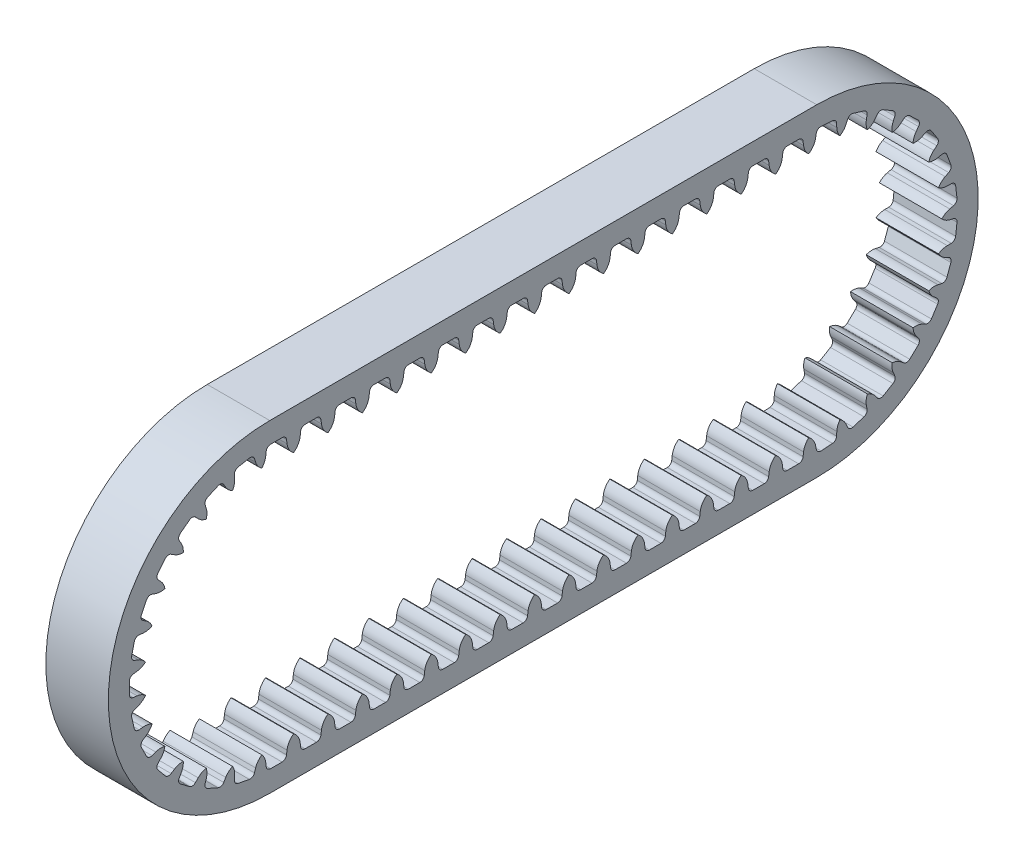
from build123d import *

# Parameters (mm, degrees)
SKETCH_2_W            = 6
SKETCH_2_H            = 3.8
CUT_EXTRUDE_1_DEPTH   = 70.800294398
PATTERN_START         = -3
PATTERN_CURVE_1_DEPTH = 6


# Read off the part's stored shape, not the designer's step: 曲线阵列1
with BuildPart() as part:
    # 扫描1: sweep along a path in 草图1
    with BuildLine(Plane(origin=(0, 0, 0), x_dir=(0, 0, -1), z_dir=(1, 0, 0))) as sweep_1_path:
        Line((0, 15.493), (52.5, 15.493))
        ThreePointArc((52.5, 15.493), (67.993, 0), (52.5, -15.493))
        Line((52.5, -15.493), (0, -15.493))
        ThreePointArc((0, -15.493), (-15.493, 0), (0, 15.493))
    # 草图2 → 扫描1 (sweep)
    with BuildSketch(Plane.XY):
        with Locations((0, 13.593)):
            Rectangle(SKETCH_2_W, SKETCH_2_H)
    sweep(path=sweep_1_path.line)

    # 草图3 → 切除-拉伸1 (cut, symmetric)
    with BuildSketch(Plane(origin=(0, 0, 0), x_dir=(0, 0, -1), z_dir=(1, 0, 0))):
        with BuildLine():
            Line((-13.482620058, 0.549918685), (-13.482620058, -0.549918685))
            ThreePointArc((-13.482620058, -0.549918685), (-13.375104421, -0.833701359), (-13.106539879, -0.975))
            Line((-13.106539879, -0.975), (-12.731034737, -1.021106234))
            ThreePointArc((-12.731034737, -1.021106234), (-11.796676034, -1.512696128), (-11.422620058, -2.5))
            Line((-11.422620058, -2.5), (-9.002225663, -2.5))
            Line((-9.002225663, -2.5), (-9.002225663, 2.5))
            Line((-9.002225663, 2.5), (-11.422620058, 2.5))
            ThreePointArc((-11.422620058, 2.5), (-11.796676034, 1.512696128), (-12.731034737, 1.021106234))
            Line((-12.731034737, 1.021106234), (-13.106539879, 0.975))
            ThreePointArc((-13.106539879, 0.975), (-13.375104421, 0.833701359), (-13.482620058, 0.549918685))
        make_face()
    extrude(amount=CUT_EXTRUDE_1_DEPTH, both=True, mode=Mode.SUBTRACT)

    # 曲线阵列1 outline → 曲线阵列1 (cut)
    with BuildSketch(Plane.YZ.offset(PATTERN_START)):
        with BuildLine():
            Line((11.693, 0), (11.693, -2.278786114))
            ThreePointArc((11.693, -2.278786114), (12.145897725, -1.857132137), (12.731034737, -1.655828627))
            Line((12.731034737, -1.655828627), (13.106539879, -1.609722393))
            ThreePointArc((13.106539879, -1.609722393), (13.37510442, -1.468423753), (13.482620058, -1.184641078))
            Line((13.482620058, -1.184641078), (13.482620058, -0.084803708))
            ThreePointArc((13.482620058, -0.084803708), (13.375104421, 0.198978967), (13.106539879, 0.340277607))
            Line((13.106539879, 0.340277607), (12.731034737, 0.386383841))
            ThreePointArc((12.731034737, 0.386383841), (12.292237647, 0.510572597), (11.911554283, 0.761662043))
            ThreePointArc((11.911554283, 0.761662043), (12.254961467, 1.126099695), (12.699710751, 1.356189612))
            Line((12.699710751, 1.356189612), (13.060164419, 1.471094137))
            ThreePointArc((13.060164419, 1.471094137), (13.297887129, 1.659721102), (13.350942903, 1.95851418))
            Line((13.350942903, 1.95851418), (13.147096097, 3.039295712))
            ThreePointArc((13.147096097, 3.039295712), (12.988846239, 3.298234317), (12.698746191, 3.387308338))
            Line((12.698746191, 3.387308338), (12.321201617, 3.363018603))
            ThreePointArc((12.321201617, 3.363018603), (11.877365704, 3.401194823), (11.464651873, 3.568870209))
            ThreePointArc((11.464651873, 3.568870209), (11.709274939, 3.941170218), (12.053023134, 4.224516155))
            Line((12.053023134, 4.224516155), (12.3776475, 4.418806962))
            ThreePointArc((12.3776475, 4.418806962), (12.56593389, 4.656799513), (12.549253423, 4.959807732))
            Line((12.549253423, 4.959807732), (12.103647301, 5.96533119))
            ThreePointArc((12.103647301, 5.96533119), (11.890375049, 6.181218117), (11.58759257, 6.201589396))
            Line((11.58759257, 6.201589396), (11.225607734, 6.091603599))
            ThreePointArc((11.225607734, 6.091603599), (10.784803103, 6.027268396), (10.344680967, 6.096117848))
            ThreePointArc((10.344680967, 6.096117848), (10.497681114, 6.51449411), (10.76752225, 6.868942276))
            Line((10.76752225, 6.868942276), (11.039112142, 7.132321903))
            ThreePointArc((11.039112142, 7.132321903), (11.167982984, 7.407066375), (11.082450345, 7.698230223))
            Line((11.082450345, 7.698230223), (10.418702146, 8.57520261))
            ThreePointArc((10.418702146, 8.57520261), (10.161710983, 8.736595797), (9.862293619, 8.687184652))
            Line((9.862293619, 8.687184652), (9.53505381, 8.497332067))
            ThreePointArc((9.53505381, 8.497332067), (9.120643217, 8.333895223), (8.676439361, 8.300269704))
            ThreePointArc((8.676439361, 8.300269704), (8.729707542, 8.742548171), (8.911339971, 9.149312724))
            Line((8.911339971, 9.149312724), (9.115501055, 9.467821985))
            ThreePointArc((9.115501055, 9.467821985), (9.178126164, 9.764756851), (9.028274602, 10.02864457))
            Line((9.028274602, 10.02864457), (8.181563148, 10.730586128))
            ThreePointArc((8.181563148, 10.730586128), (7.894473671, 10.828931697), (7.614290619, 10.712356929))
            Line((7.614290619, 10.712356929), (7.339139628, 10.452699791))
            ThreePointArc((7.339139628, 10.452699791), (6.973086939, 10.198823502), (6.548344279, 10.064505171))
            ThreePointArc((6.548344279, 10.064505171), (6.499057268, 10.507244972), (6.582854426, 10.944767289))
            Line((6.582854426, 10.944767289), (6.708766112, 11.301525112))
            ThreePointArc((6.708766112, 11.301525112), (6.701826341, 11.604912749), (6.495598029, 11.827538224))
            Line((6.495598029, 11.827538224), (5.510799239, 12.317245875))
            ThreePointArc((5.510799239, 12.317245875), (5.208827262, 12.347331484), (4.962728295, 12.169771587))
            Line((4.962728295, 12.169771587), (4.754249195, 11.85407179))
            ThreePointArc((4.754249195, 11.85407179), (4.455955295, 11.523211562), (4.073185299, 11.295319325))
            ThreePointArc((4.073185299, 11.295319325), (3.923955319, 11.71505514), (3.905475935, 12.160146427))
            Line((3.905475935, 12.160146427), (3.946464873, 12.536244558))
            ThreePointArc((3.946464873, 12.536244558), (3.870328031, 12.830005345), (3.618653121, 12.999569369))
            Line((3.618653121, 12.999569369), (2.54796158, 13.251088483))
            ThreePointArc((2.54796158, 13.251088483), (2.247111695, 13.211319588), (2.048140119, 12.982185281))
            Line((2.048140119, 12.982185281), (1.917382355, 12.627174994))
            ThreePointArc((1.917382355, 12.627174994), (1.702656896, 12.236866502), (1.38214647, 11.927478705))
            ThreePointArc((1.38214647, 11.927478705), (1.639780157, 11.696017485), (1.943890519, 11.530287882))
            ThreePointArc((1.943890519, 11.530287882), (8.929058204, 7.549713145), (11.693, 0))
        make_face()
        with BuildLine():
            Line((11.693, -2.295855782), (11.693, -5.583983225))
            ThreePointArc((11.693, -5.583983225), (12.145897725, -5.162329247), (12.731034737, -4.961025738))
            Line((12.731034737, -4.961025738), (13.106539879, -4.914919503))
            ThreePointArc((13.106539879, -4.914919503), (13.375104421, -4.773620863), (13.482620058, -4.489838188))
            Line((13.482620058, -4.489838188), (13.482620058, -3.390000819))
            ThreePointArc((13.482620058, -3.390000819), (13.375104421, -3.106218144), (13.106539879, -2.964919503))
            Line((13.106539879, -2.964919503), (12.731034737, -2.918813269))
            ThreePointArc((12.731034737, -2.918813269), (12.145897725, -2.71750976), (11.693, -2.295855782))
        make_face()
        with BuildLine():
            Line((11.693, -5.601052893), (11.693, -8.889180335))
            ThreePointArc((11.693, -8.889180335), (12.145897725, -8.467526358), (12.731034737, -8.266222848))
            Line((12.731034737, -8.266222848), (13.106539879, -8.220116614))
            ThreePointArc((13.106539879, -8.220116614), (13.37510442, -8.078817974), (13.482620058, -7.795035299))
            Line((13.482620058, -7.795035299), (13.482620058, -6.695197929))
            ThreePointArc((13.482620058, -6.695197929), (13.37510442, -6.411415254), (13.106539879, -6.270116614))
            Line((13.106539879, -6.270116614), (12.731034737, -6.22401038))
            ThreePointArc((12.731034737, -6.22401038), (12.145897725, -6.02270687), (11.693, -5.601052893))
        make_face()
        with BuildLine():
            Line((11.693, -8.906250003), (11.693, -12.194377446))
            ThreePointArc((11.693, -12.194377446), (12.145897725, -11.772723468), (12.731034737, -11.571419959))
            Line((12.731034737, -11.571419959), (13.106539879, -11.525313725))
            ThreePointArc((13.106539879, -11.525313725), (13.375104421, -11.384015084), (13.482620058, -11.100232409))
            Line((13.482620058, -11.100232409), (13.482620058, -10.00039504))
            ThreePointArc((13.482620058, -10.00039504), (13.375104421, -9.716612365), (13.106539879, -9.575313725))
            Line((13.106539879, -9.575313725), (12.731034737, -9.529207491))
            ThreePointArc((12.731034737, -9.529207491), (12.145897725, -9.327903981), (11.693, -8.906250003))
        make_face()
        with BuildLine():
            Line((11.693, -12.211447114), (11.693, -15.499574557))
            ThreePointArc((11.693, -15.499574557), (12.145897725, -15.077920579), (12.731034737, -14.876617069))
            Line((12.731034737, -14.876617069), (13.106539879, -14.830510835))
            ThreePointArc((13.106539879, -14.830510835), (13.375104421, -14.689212195), (13.482620058, -14.40542952))
            Line((13.482620058, -14.40542952), (13.482620058, -13.30559215))
            ThreePointArc((13.482620058, -13.30559215), (13.37510442, -13.021809475), (13.106539879, -12.880510835))
            Line((13.106539879, -12.880510835), (12.731034737, -12.834404601))
            ThreePointArc((12.731034737, -12.834404601), (12.145897725, -12.633101092), (11.693, -12.211447114))
        make_face()
        with BuildLine():
            Line((11.693, -15.516644224), (11.693, -18.804771667))
            ThreePointArc((11.693, -18.804771667), (12.145897725, -18.38311769), (12.731034737, -18.18181418))
            Line((12.731034737, -18.18181418), (13.106539879, -18.135707946))
            ThreePointArc((13.106539879, -18.135707946), (13.37510442, -17.994409306), (13.482620058, -17.710626631))
            Line((13.482620058, -17.710626631), (13.482620058, -16.610789261))
            ThreePointArc((13.482620058, -16.610789261), (13.375104421, -16.327006586), (13.106539879, -16.185707946))
            Line((13.106539879, -16.185707946), (12.731034737, -16.139601712))
            ThreePointArc((12.731034737, -16.139601712), (12.145897725, -15.938298202), (11.693, -15.516644224))
        make_face()
        with BuildLine():
            Line((11.693, -18.821841335), (11.693, -22.109968778))
            ThreePointArc((11.693, -22.109968778), (12.145897725, -21.6883148), (12.731034737, -21.487011291))
            Line((12.731034737, -21.487011291), (13.106539879, -21.440905056))
            ThreePointArc((13.106539879, -21.440905056), (13.375104421, -21.299606416), (13.482620058, -21.015823741))
            Line((13.482620058, -21.015823741), (13.482620058, -19.915986372))
            ThreePointArc((13.482620058, -19.915986372), (13.375104421, -19.632203697), (13.106539879, -19.490905056))
            Line((13.106539879, -19.490905056), (12.731034737, -19.444798822))
            ThreePointArc((12.731034737, -19.444798822), (12.145897725, -19.243495313), (11.693, -18.821841335))
        make_face()
        with BuildLine():
            Line((11.693, -22.127038446), (11.693, -25.415165888))
            ThreePointArc((11.693, -25.415165888), (12.145897725, -24.993511911), (12.731034737, -24.792208401))
            Line((12.731034737, -24.792208401), (13.106539879, -24.746102167))
            ThreePointArc((13.106539879, -24.746102167), (13.37510442, -24.604803527), (13.482620058, -24.321020852))
            Line((13.482620058, -24.321020852), (13.482620058, -23.221183482))
            ThreePointArc((13.482620058, -23.221183482), (13.37510442, -22.937400807), (13.106539879, -22.796102167))
            Line((13.106539879, -22.796102167), (12.731034737, -22.749995933))
            ThreePointArc((12.731034737, -22.749995933), (12.145897725, -22.548692423), (11.693, -22.127038446))
        make_face()
        with BuildLine():
            Line((11.693, -25.432235556), (11.693, -28.720362999))
            ThreePointArc((11.693, -28.720362999), (12.145897725, -28.298709021), (12.731034737, -28.097405512))
            Line((12.731034737, -28.097405512), (13.106539879, -28.051299278))
            ThreePointArc((13.106539879, -28.051299278), (13.375104421, -27.910000637), (13.482620058, -27.626217962))
            Line((13.482620058, -27.626217962), (13.482620058, -26.526380593))
            ThreePointArc((13.482620058, -26.526380593), (13.375104421, -26.242597918), (13.106539879, -26.101299278))
            Line((13.106539879, -26.101299278), (12.731034737, -26.055193044))
            ThreePointArc((12.731034737, -26.055193044), (12.145897725, -25.853889534), (11.693, -25.432235556))
        make_face()
        with BuildLine():
            Line((11.693, -28.737432667), (11.693, -32.02556011))
            ThreePointArc((11.693, -32.02556011), (12.145897725, -31.603906132), (12.731034737, -31.402602622))
            Line((12.731034737, -31.402602622), (13.106539879, -31.356496388))
            ThreePointArc((13.106539879, -31.356496388), (13.375104421, -31.215197748), (13.482620058, -30.931415073))
            Line((13.482620058, -30.931415073), (13.482620058, -29.831577703))
            ThreePointArc((13.482620058, -29.831577703), (13.37510442, -29.547795028), (13.106539879, -29.406496388))
            Line((13.106539879, -29.406496388), (12.731034737, -29.360390154))
            ThreePointArc((12.731034737, -29.360390154), (12.145897725, -29.159086645), (11.693, -28.737432667))
        make_face()
        with BuildLine():
            Line((11.693, -32.042629777), (11.693, -35.33075722))
            ThreePointArc((11.693, -35.33075722), (12.145897725, -34.909103243), (12.731034737, -34.707799733))
            Line((12.731034737, -34.707799733), (13.106539879, -34.661693499))
            ThreePointArc((13.106539879, -34.661693499), (13.37510442, -34.520394859), (13.482620058, -34.236612184))
            Line((13.482620058, -34.236612184), (13.482620058, -33.136774814))
            ThreePointArc((13.482620058, -33.136774814), (13.375104421, -32.852992139), (13.106539879, -32.711693499))
            Line((13.106539879, -32.711693499), (12.731034737, -32.665587265))
            ThreePointArc((12.731034737, -32.665587265), (12.145897725, -32.464283755), (11.693, -32.042629777))
        make_face()
        with BuildLine():
            Line((11.693, -35.347826888), (11.693, -38.635954331))
            ThreePointArc((11.693, -38.635954331), (12.145897725, -38.214300353), (12.731034737, -38.012996844))
            Line((12.731034737, -38.012996844), (13.106539879, -37.966890609))
            ThreePointArc((13.106539879, -37.966890609), (13.375104421, -37.825591969), (13.482620058, -37.541809294))
            Line((13.482620058, -37.541809294), (13.482620058, -36.441971925))
            ThreePointArc((13.482620058, -36.441971925), (13.375104421, -36.15818925), (13.106539879, -36.016890609))
            Line((13.106539879, -36.016890609), (12.731034737, -35.970784375))
            ThreePointArc((12.731034737, -35.970784375), (12.145897725, -35.769480866), (11.693, -35.347826888))
        make_face()
        with BuildLine():
            Line((11.693, -38.653023999), (11.693, -41.941151441))
            ThreePointArc((11.693, -41.941151441), (12.145897725, -41.519497464), (12.731034737, -41.318193954))
            Line((12.731034737, -41.318193954), (13.106539879, -41.27208772))
            ThreePointArc((13.106539879, -41.27208772), (13.37510442, -41.13078908), (13.482620058, -40.847006405))
            Line((13.482620058, -40.847006405), (13.482620058, -39.747169035))
            ThreePointArc((13.482620058, -39.747169035), (13.37510442, -39.46338636), (13.106539879, -39.32208772))
            Line((13.106539879, -39.32208772), (12.731034737, -39.275981486))
            ThreePointArc((12.731034737, -39.275981486), (12.145897725, -39.074677976), (11.693, -38.653023999))
        make_face()
        with BuildLine():
            Line((11.693, -41.958221109), (11.693, -45.246348552))
            ThreePointArc((11.693, -45.246348552), (12.145897725, -44.824694574), (12.731034737, -44.623391065))
            Line((12.731034737, -44.623391065), (13.106539879, -44.577284831))
            ThreePointArc((13.106539879, -44.577284831), (13.375104421, -44.43598619), (13.482620058, -44.152203515))
            Line((13.482620058, -44.152203515), (13.482620058, -43.052366146))
            ThreePointArc((13.482620058, -43.052366146), (13.375104421, -42.768583471), (13.106539879, -42.627284831))
            Line((13.106539879, -42.627284831), (12.731034737, -42.581178597))
            ThreePointArc((12.731034737, -42.581178597), (12.145897725, -42.379875087), (11.693, -41.958221109))
        make_face()
        with BuildLine():
            Line((11.693, -45.26341822), (11.693, -48.551545663))
            ThreePointArc((11.693, -48.551545663), (12.145897725, -48.129891685), (12.731034737, -47.928588175))
            Line((12.731034737, -47.928588175), (13.106539879, -47.882481941))
            ThreePointArc((13.106539879, -47.882481941), (13.375104421, -47.741183301), (13.482620058, -47.457400626))
            Line((13.482620058, -47.457400626), (13.482620058, -46.357563256))
            ThreePointArc((13.482620058, -46.357563256), (13.37510442, -46.073780581), (13.106539879, -45.932481941))
            Line((13.106539879, -45.932481941), (12.731034737, -45.886375707))
            ThreePointArc((12.731034737, -45.886375707), (12.145897725, -45.685072198), (11.693, -45.26341822))
        make_face()
        with BuildLine():
            Line((-11.693, -52.5), (-11.693, -48.56861533))
            ThreePointArc((-11.693, -48.56861533), (-12.145897725, -48.990269308), (-12.731034737, -49.191572818))
            Line((-12.731034737, -49.191572818), (-13.106539879, -49.237679052))
            ThreePointArc((-13.106539879, -49.237679052), (-13.375104421, -49.378977692), (-13.482620058, -49.662760367))
            Line((-13.482620058, -49.662760367), (-13.482620058, -50.762597737))
            ThreePointArc((-13.482620058, -50.762597737), (-13.37510442, -51.046380412), (-13.106539879, -51.187679052))
            Line((-13.106539879, -51.187679052), (-12.731034737, -51.233785286))
            ThreePointArc((-12.731034737, -51.233785286), (-12.220915878, -51.392964944), (-11.799767173, -51.721892266))
            ThreePointArc((-11.799767173, -51.721892266), (-12.217330876, -52.153571456), (-12.771403722, -52.385324885))
            Line((-12.771403722, -52.385324885), (-13.142687946, -52.457974193))
            ThreePointArc((-13.142687946, -52.457974193), (-13.400543129, -52.617983328), (-13.487639984, -52.908683098))
            Line((-13.487639984, -52.908683098), (-13.409555765, -54.005745127))
            ThreePointArc((-13.409555765, -54.005745127), (-13.282163956, -54.281178505), (-13.004245454, -54.403053543))
            Line((-13.004245454, -54.403053543), (-12.6264145, -54.422384013))
            ThreePointArc((-12.6264145, -54.422384013), (-12.189923242, -54.511395942), (-11.799253703, -54.725463812))
            ThreePointArc((-11.799253703, -54.725463812), (-12.085105781, -55.0671308), (-12.459184684, -55.309024819))
            Line((-12.459184684, -55.309024819), (-12.804015836, -55.464656991))
            ThreePointArc((-12.804015836, -55.464656991), (-13.018445728, -55.679394133), (-13.036755086, -55.98230829))
            Line((-13.036755086, -55.98230829), (-12.709855682, -57.032441148))
            ThreePointArc((-12.709855682, -57.032441148), (-12.522851587, -57.271442586), (-12.224426656, -57.326531418))
            Line((-12.224426656, -57.326531418), (-11.852187633, -57.258944393))
            ThreePointArc((-11.852187633, -57.258944393), (-11.406907529, -57.245777378), (-10.977636125, -57.364831163))
            ThreePointArc((-10.977636125, -57.364831163), (-11.1777781, -57.762814745), (-11.486625714, -58.083845729))
            Line((-11.486625714, -58.083845729), (-11.786727657, -58.31421222))
            ThreePointArc((-11.786727657, -58.31421222), (-11.946367419, -58.572296248), (-11.89491888, -58.871370263))
            Line((-11.89491888, -58.871370263), (-11.336530041, -59.818916644))
            ThreePointArc((-11.336530041, -59.818916644), (-11.099824925, -60.008819006), (-10.796710162, -59.994201911))
            Line((-10.796710162, -59.994201911), (-10.449791831, -59.84327952))
            ThreePointArc((-10.449791831, -59.84327952), (-10.019322838, -59.728631417), (-9.574201062, -59.746361235))
            ThreePointArc((-9.574201062, -59.746361235), (-9.67802536, -60.17956818), (-9.905272683, -60.562721407))
            Line((-9.905272683, -60.562721407), (-10.144739939, -60.855612735))
            ThreePointArc((-10.144739939, -60.855612735), (-10.241128622, -61.14336513), (-10.122648973, -61.422748006))
            Line((-10.122648973, -61.422748006), (-9.362365448, -62.217487712))
            ThreePointArc((-9.362365448, -62.217487712), (-9.088504742, -62.348226124), (-8.796765306, -62.264677811))
            Line((-8.796765306, -62.264677811), (-8.493554426, -62.038418979))
            ThreePointArc((-8.493554426, -62.038418979), (-8.100711509, -61.828366166), (-7.663330928, -61.743832334))
            ThreePointArc((-7.663330928, -61.743832334), (-7.665334834, -62.189302564), (-7.798937702, -62.614270816))
            Line((-7.798937702, -62.614270816), (-7.965078445, -62.954163667))
            ThreePointArc((-7.965078445, -62.954163667), (-7.993107426, -63.256333479), (-7.813876116, -63.501217852))
            Line((-7.813876116, -63.501217852), (-6.891993124, -64.101029479))
            ThreePointArc((-6.891993124, -64.101029479), (-6.595491514, -64.165674773), (-6.330589669, -64.017623325))
            Line((-6.330589669, -64.017623325), (-6.087156494, -63.728019827))
            ThreePointArc((-6.087156494, -63.728019827), (-5.752760428, -63.433695155), (-5.346302322, -63.251377987))
            ThreePointArc((-5.346302322, -63.251377987), (-5.246379628, -63.685501468), (-5.279257055, -64.12976132))
            Line((-5.279257055, -64.12976132), (-5.363265783, -64.498641288))
            ThreePointArc((-5.363265783, -64.498641288), (-5.321449519, -64.79921344), (-5.090965854, -64.996620378))
            Line((-5.090965854, -64.996620378), (-4.056343426, -65.369713758))
            ThreePointArc((-4.056343426, -65.369713758), (-3.752915572, -65.364839717), (-3.528891183, -65.160131896))
            Line((-3.528891183, -65.160131896), (-3.358137732, -64.822532791))
            ThreePointArc((-3.358137732, -64.822532791), (-3.099911591, -64.459535543), (-2.745918343, -64.189097894))
            ThreePointArc((-2.745918343, -64.189097894), (-2.549364978, -64.588865972), (-2.479774452, -65.028871541))
            Line((-2.479774452, -65.028871541), (-2.477198682, -65.407187893))
            ThreePointArc((-2.477198682, -65.407187893), (-2.367753445, -65.690231986), (-2.098233118, -65.829698871))
            Line((-2.098233118, -65.829698871), (-1.005706503, -65.956299961))
            ThreePointArc((-1.005706503, -65.956299961), (-0.711434158, -65.882164909), (-0.540160574, -65.631650283))
            Line((-0.540160574, -65.631650283), (-0.451136823, -65.263948409))
            ThreePointArc((-0.451136823, -65.263948409), (-0.282766659, -64.85151753), (0, -64.507292664))
            ThreePointArc((0, -64.507292664), (0.282766659, -64.85151753), (0.451136823, -65.263948409))
            Line((0.451136823, -65.263948409), (0.540160574, -65.631650283))
            ThreePointArc((0.540160574, -65.631650283), (0.711434158, -65.882164909), (1.005706503, -65.956299961))
            Line((1.005706503, -65.956299961), (2.098233118, -65.829698871))
            ThreePointArc((2.098233118, -65.829698871), (2.367753445, -65.690231986), (2.477198682, -65.407187893))
            Line((2.477198682, -65.407187893), (2.479774452, -65.028871541))
            ThreePointArc((2.479774452, -65.028871541), (2.549364978, -64.588865972), (2.745918343, -64.189097894))
            ThreePointArc((2.745918343, -64.189097894), (3.099911591, -64.459535543), (3.358137732, -64.822532791))
            Line((3.358137732, -64.822532791), (3.528891183, -65.160131896))
            ThreePointArc((3.528891183, -65.160131896), (3.752915572, -65.364839717), (4.056343426, -65.369713758))
            Line((4.056343426, -65.369713758), (5.090965854, -64.996620378))
            ThreePointArc((5.090965854, -64.996620378), (5.321449519, -64.79921344), (5.363265783, -64.498641288))
            Line((5.363265783, -64.498641288), (5.279257055, -64.12976132))
            ThreePointArc((5.279257055, -64.12976132), (5.246379628, -63.685501468), (5.346302322, -63.251377987))
            ThreePointArc((5.346302322, -63.251377987), (5.752760428, -63.433695155), (6.087156494, -63.728019827))
            Line((6.087156494, -63.728019827), (6.330589669, -64.017623325))
            ThreePointArc((6.330589669, -64.017623325), (6.595491514, -64.165674773), (6.891993124, -64.101029479))
            Line((6.891993124, -64.101029479), (7.813876116, -63.501217852))
            ThreePointArc((7.813876116, -63.501217852), (7.993107426, -63.256333479), (7.965078445, -62.954163667))
            Line((7.965078445, -62.954163667), (7.798937702, -62.614270816))
            ThreePointArc((7.798937702, -62.614270816), (7.665334834, -62.189302564), (7.663330928, -61.743832334))
            ThreePointArc((7.663330928, -61.743832334), (8.100711509, -61.828366166), (8.493554426, -62.038418979))
            Line((8.493554426, -62.038418979), (8.796765306, -62.264677811))
            ThreePointArc((8.796765306, -62.264677811), (9.088504742, -62.348226124), (9.362365448, -62.217487712))
            Line((9.362365448, -62.217487712), (10.122648973, -61.422748006))
            ThreePointArc((10.122648973, -61.422748006), (10.241128622, -61.14336513), (10.144739939, -60.855612735))
            Line((10.144739939, -60.855612735), (9.905272683, -60.562721407))
            ThreePointArc((9.905272683, -60.562721407), (9.67802536, -60.17956818), (9.574201062, -59.746361235))
            ThreePointArc((9.574201062, -59.746361235), (10.019322838, -59.728631417), (10.449791831, -59.84327952))
            Line((10.449791831, -59.84327952), (10.796710162, -59.994201911))
            ThreePointArc((10.796710162, -59.994201911), (11.099824925, -60.008819006), (11.336530041, -59.818916644))
            Line((11.336530041, -59.818916644), (11.89491888, -58.871370263))
            ThreePointArc((11.89491888, -58.871370263), (11.946367419, -58.572296248), (11.786727657, -58.31421222))
            Line((11.786727657, -58.31421222), (11.486625714, -58.083845729))
            ThreePointArc((11.486625714, -58.083845729), (11.1777781, -57.762814745), (10.977636125, -57.364831163))
            ThreePointArc((10.977636125, -57.364831163), (11.406907529, -57.245777378), (11.852187633, -57.258944393))
            Line((11.852187633, -57.258944393), (12.224426656, -57.326531418))
            ThreePointArc((12.224426656, -57.326531418), (12.522851587, -57.271442586), (12.709855682, -57.032441148))
            Line((12.709855682, -57.032441148), (13.036755086, -55.98230829))
            ThreePointArc((13.036755086, -55.98230829), (13.018445728, -55.679394133), (12.804015836, -55.464656991))
            Line((12.804015836, -55.464656991), (12.459184684, -55.309024819))
            ThreePointArc((12.459184684, -55.309024819), (12.085105781, -55.0671308), (11.799253703, -54.725463812))
            ThreePointArc((11.799253703, -54.725463812), (12.189923242, -54.511395942), (12.6264145, -54.422384013))
            Line((12.6264145, -54.422384013), (13.004245454, -54.403053543))
            ThreePointArc((13.004245454, -54.403053543), (13.282163956, -54.281178505), (13.409555765, -54.005745127))
            Line((13.409555765, -54.005745127), (13.487639984, -52.908683098))
            ThreePointArc((13.487639984, -52.908683098), (13.400543129, -52.617983328), (13.142687946, -52.457974193))
            Line((13.142687946, -52.457974193), (12.771403722, -52.385324885))
            ThreePointArc((12.771403722, -52.385324885), (12.217330876, -52.153571456), (11.799767173, -51.721892266))
            ThreePointArc((11.799767173, -51.721892266), (12.220915878, -51.392964944), (12.731034737, -51.233785286))
            Line((12.731034737, -51.233785286), (13.106539879, -51.187679052))
            ThreePointArc((13.106539879, -51.187679052), (13.37510442, -51.046380412), (13.482620058, -50.762597737))
            Line((13.482620058, -50.762597737), (13.482620058, -49.662760367))
            ThreePointArc((13.482620058, -49.662760367), (13.375104421, -49.378977692), (13.106539879, -49.237679052))
            Line((13.106539879, -49.237679052), (12.731034737, -49.191572818))
            ThreePointArc((12.731034737, -49.191572818), (12.145897725, -48.990269308), (11.693, -48.56861533))
            Line((11.693, -48.56861533), (11.693, -52.5))
            ThreePointArc((11.693, -52.5), (0, -64.193), (-11.693, -52.5))
        make_face()
        with BuildLine():
            Line((-11.693, -48.551545663), (-11.693, -45.26341822))
            ThreePointArc((-11.693, -45.26341822), (-12.145897725, -45.685072198), (-12.731034737, -45.886375707))
            Line((-12.731034737, -45.886375707), (-13.106539879, -45.932481941))
            ThreePointArc((-13.106539879, -45.932481941), (-13.37510442, -46.073780581), (-13.482620058, -46.357563256))
            Line((-13.482620058, -46.357563256), (-13.482620058, -47.457400626))
            ThreePointArc((-13.482620058, -47.457400626), (-13.375104421, -47.741183301), (-13.106539879, -47.882481941))
            Line((-13.106539879, -47.882481941), (-12.731034737, -47.928588175))
            ThreePointArc((-12.731034737, -47.928588175), (-12.145897725, -48.129891685), (-11.693, -48.551545663))
        make_face()
        with BuildLine():
            Line((-11.693, -45.246348552), (-11.693, -41.958221109))
            ThreePointArc((-11.693, -41.958221109), (-12.145897725, -42.379875087), (-12.731034737, -42.581178597))
            Line((-12.731034737, -42.581178597), (-13.106539879, -42.627284831))
            ThreePointArc((-13.106539879, -42.627284831), (-13.375104421, -42.768583471), (-13.482620058, -43.052366146))
            Line((-13.482620058, -43.052366146), (-13.482620058, -44.152203515))
            ThreePointArc((-13.482620058, -44.152203515), (-13.375104421, -44.43598619), (-13.106539879, -44.577284831))
            Line((-13.106539879, -44.577284831), (-12.731034737, -44.623391065))
            ThreePointArc((-12.731034737, -44.623391065), (-12.145897725, -44.824694574), (-11.693, -45.246348552))
        make_face()
        with BuildLine():
            Line((-11.693, -41.941151441), (-11.693, -38.653023999))
            ThreePointArc((-11.693, -38.653023999), (-12.145897725, -39.074677976), (-12.731034737, -39.275981486))
            Line((-12.731034737, -39.275981486), (-13.106539879, -39.32208772))
            ThreePointArc((-13.106539879, -39.32208772), (-13.37510442, -39.46338636), (-13.482620058, -39.747169035))
            Line((-13.482620058, -39.747169035), (-13.482620058, -40.847006405))
            ThreePointArc((-13.482620058, -40.847006405), (-13.37510442, -41.13078908), (-13.106539879, -41.27208772))
            Line((-13.106539879, -41.27208772), (-12.731034737, -41.318193954))
            ThreePointArc((-12.731034737, -41.318193954), (-12.145897725, -41.519497464), (-11.693, -41.941151441))
        make_face()
        with BuildLine():
            Line((-11.693, -38.635954331), (-11.693, -35.347826888))
            ThreePointArc((-11.693, -35.347826888), (-12.145897725, -35.769480866), (-12.731034737, -35.970784375))
            Line((-12.731034737, -35.970784375), (-13.106539879, -36.016890609))
            ThreePointArc((-13.106539879, -36.016890609), (-13.375104421, -36.15818925), (-13.482620058, -36.441971925))
            Line((-13.482620058, -36.441971925), (-13.482620058, -37.541809294))
            ThreePointArc((-13.482620058, -37.541809294), (-13.375104421, -37.825591969), (-13.106539879, -37.966890609))
            Line((-13.106539879, -37.966890609), (-12.731034737, -38.012996844))
            ThreePointArc((-12.731034737, -38.012996844), (-12.145897725, -38.214300353), (-11.693, -38.635954331))
        make_face()
        with BuildLine():
            Line((-11.693, -35.33075722), (-11.693, -32.042629777))
            ThreePointArc((-11.693, -32.042629777), (-12.145897725, -32.464283755), (-12.731034737, -32.665587265))
            Line((-12.731034737, -32.665587265), (-13.106539879, -32.711693499))
            ThreePointArc((-13.106539879, -32.711693499), (-13.375104421, -32.852992139), (-13.482620058, -33.136774814))
            Line((-13.482620058, -33.136774814), (-13.482620058, -34.236612184))
            ThreePointArc((-13.482620058, -34.236612184), (-13.37510442, -34.520394859), (-13.106539879, -34.661693499))
            Line((-13.106539879, -34.661693499), (-12.731034737, -34.707799733))
            ThreePointArc((-12.731034737, -34.707799733), (-12.145897725, -34.909103243), (-11.693, -35.33075722))
        make_face()
        with BuildLine():
            Line((-11.693, -32.02556011), (-11.693, -28.737432667))
            ThreePointArc((-11.693, -28.737432667), (-12.145897725, -29.159086645), (-12.731034737, -29.360390154))
            Line((-12.731034737, -29.360390154), (-13.106539879, -29.406496388))
            ThreePointArc((-13.106539879, -29.406496388), (-13.37510442, -29.547795028), (-13.482620058, -29.831577703))
            Line((-13.482620058, -29.831577703), (-13.482620058, -30.931415073))
            ThreePointArc((-13.482620058, -30.931415073), (-13.375104421, -31.215197748), (-13.106539879, -31.356496388))
            Line((-13.106539879, -31.356496388), (-12.731034737, -31.402602622))
            ThreePointArc((-12.731034737, -31.402602622), (-12.145897725, -31.603906132), (-11.693, -32.02556011))
        make_face()
        with BuildLine():
            Line((-11.693, -28.720362999), (-11.693, -25.432235556))
            ThreePointArc((-11.693, -25.432235556), (-12.145897725, -25.853889534), (-12.731034737, -26.055193044))
            Line((-12.731034737, -26.055193044), (-13.106539879, -26.101299278))
            ThreePointArc((-13.106539879, -26.101299278), (-13.375104421, -26.242597918), (-13.482620058, -26.526380593))
            Line((-13.482620058, -26.526380593), (-13.482620058, -27.626217962))
            ThreePointArc((-13.482620058, -27.626217962), (-13.375104421, -27.910000637), (-13.106539879, -28.051299278))
            Line((-13.106539879, -28.051299278), (-12.731034737, -28.097405512))
            ThreePointArc((-12.731034737, -28.097405512), (-12.145897725, -28.298709021), (-11.693, -28.720362999))
        make_face()
        with BuildLine():
            Line((-11.693, -25.415165888), (-11.693, -22.127038446))
            ThreePointArc((-11.693, -22.127038446), (-12.145897725, -22.548692423), (-12.731034737, -22.749995933))
            Line((-12.731034737, -22.749995933), (-13.106539879, -22.796102167))
            ThreePointArc((-13.106539879, -22.796102167), (-13.37510442, -22.937400807), (-13.482620058, -23.221183482))
            Line((-13.482620058, -23.221183482), (-13.482620058, -24.321020852))
            ThreePointArc((-13.482620058, -24.321020852), (-13.37510442, -24.604803527), (-13.106539879, -24.746102167))
            Line((-13.106539879, -24.746102167), (-12.731034737, -24.792208401))
            ThreePointArc((-12.731034737, -24.792208401), (-12.145897725, -24.993511911), (-11.693, -25.415165888))
        make_face()
        with BuildLine():
            Line((-11.693, -22.109968778), (-11.693, -18.821841335))
            ThreePointArc((-11.693, -18.821841335), (-12.145897725, -19.243495313), (-12.731034737, -19.444798822))
            Line((-12.731034737, -19.444798822), (-13.106539879, -19.490905056))
            ThreePointArc((-13.106539879, -19.490905056), (-13.375104421, -19.632203697), (-13.482620058, -19.915986372))
            Line((-13.482620058, -19.915986372), (-13.482620058, -21.015823741))
            ThreePointArc((-13.482620058, -21.015823741), (-13.375104421, -21.299606416), (-13.106539879, -21.440905056))
            Line((-13.106539879, -21.440905056), (-12.731034737, -21.487011291))
            ThreePointArc((-12.731034737, -21.487011291), (-12.145897725, -21.6883148), (-11.693, -22.109968778))
        make_face()
        with BuildLine():
            Line((-11.693, -18.804771667), (-11.693, -15.516644224))
            ThreePointArc((-11.693, -15.516644224), (-12.145897725, -15.938298202), (-12.731034737, -16.139601712))
            Line((-12.731034737, -16.139601712), (-13.106539879, -16.185707946))
            ThreePointArc((-13.106539879, -16.185707946), (-13.375104421, -16.327006586), (-13.482620058, -16.610789261))
            Line((-13.482620058, -16.610789261), (-13.482620058, -17.710626631))
            ThreePointArc((-13.482620058, -17.710626631), (-13.37510442, -17.994409306), (-13.106539879, -18.135707946))
            Line((-13.106539879, -18.135707946), (-12.731034737, -18.18181418))
            ThreePointArc((-12.731034737, -18.18181418), (-12.145897725, -18.38311769), (-11.693, -18.804771667))
        make_face()
        with BuildLine():
            Line((-11.693, -15.499574557), (-11.693, -12.211447114))
            ThreePointArc((-11.693, -12.211447114), (-12.145897725, -12.633101092), (-12.731034737, -12.834404601))
            Line((-12.731034737, -12.834404601), (-13.106539879, -12.880510835))
            ThreePointArc((-13.106539879, -12.880510835), (-13.37510442, -13.021809475), (-13.482620058, -13.30559215))
            Line((-13.482620058, -13.30559215), (-13.482620058, -14.40542952))
            ThreePointArc((-13.482620058, -14.40542952), (-13.375104421, -14.689212195), (-13.106539879, -14.830510835))
            Line((-13.106539879, -14.830510835), (-12.731034737, -14.876617069))
            ThreePointArc((-12.731034737, -14.876617069), (-12.145897725, -15.077920579), (-11.693, -15.499574557))
        make_face()
        with BuildLine():
            Line((-11.693, -12.194377446), (-11.693, -8.906250003))
            ThreePointArc((-11.693, -8.906250003), (-12.145897725, -9.327903981), (-12.731034737, -9.529207491))
            Line((-12.731034737, -9.529207491), (-13.106539879, -9.575313725))
            ThreePointArc((-13.106539879, -9.575313725), (-13.375104421, -9.716612365), (-13.482620058, -10.00039504))
            Line((-13.482620058, -10.00039504), (-13.482620058, -11.100232409))
            ThreePointArc((-13.482620058, -11.100232409), (-13.375104421, -11.384015084), (-13.106539879, -11.525313725))
            Line((-13.106539879, -11.525313725), (-12.731034737, -11.571419959))
            ThreePointArc((-12.731034737, -11.571419959), (-12.145897725, -11.772723468), (-11.693, -12.194377446))
        make_face()
        with BuildLine():
            Line((-11.693, -8.889180335), (-11.693, -5.601052893))
            ThreePointArc((-11.693, -5.601052893), (-12.145897725, -6.02270687), (-12.731034737, -6.22401038))
            Line((-12.731034737, -6.22401038), (-13.106539879, -6.270116614))
            ThreePointArc((-13.106539879, -6.270116614), (-13.37510442, -6.411415254), (-13.482620058, -6.695197929))
            Line((-13.482620058, -6.695197929), (-13.482620058, -7.795035299))
            ThreePointArc((-13.482620058, -7.795035299), (-13.37510442, -8.078817974), (-13.106539879, -8.220116614))
            Line((-13.106539879, -8.220116614), (-12.731034737, -8.266222848))
            ThreePointArc((-12.731034737, -8.266222848), (-12.145897725, -8.467526358), (-11.693, -8.889180335))
        make_face()
        with BuildLine():
            Line((-11.693, -5.583983225), (-11.693, -2.295855782))
            ThreePointArc((-11.693, -2.295855782), (-12.145897725, -2.71750976), (-12.731034737, -2.918813269))
            Line((-12.731034737, -2.918813269), (-13.106539879, -2.964919503))
            ThreePointArc((-13.106539879, -2.964919503), (-13.375104421, -3.106218144), (-13.482620058, -3.390000819))
            Line((-13.482620058, -3.390000819), (-13.482620058, -4.489838188))
            ThreePointArc((-13.482620058, -4.489838188), (-13.375104421, -4.773620863), (-13.106539879, -4.914919503))
            Line((-13.106539879, -4.914919503), (-12.731034737, -4.961025738))
            ThreePointArc((-12.731034737, -4.961025738), (-12.145897725, -5.162329247), (-11.693, -5.583983225))
        make_face()
        with BuildLine():
            ThreePointArc((-1.38214647, 11.927478705), (-1.702656896, 12.236866502), (-1.917382355, 12.627174994))
            Line((-1.917382355, 12.627174994), (-2.048140119, 12.982185281))
            ThreePointArc((-2.048140119, 12.982185281), (-2.247111695, 13.211319588), (-2.54796158, 13.251088483))
            Line((-2.54796158, 13.251088483), (-3.618653121, 12.999569369))
            ThreePointArc((-3.618653121, 12.999569369), (-3.870328031, 12.830005345), (-3.946464873, 12.536244558))
            Line((-3.946464873, 12.536244558), (-3.905475935, 12.160146427))
            ThreePointArc((-3.905475935, 12.160146427), (-3.923955319, 11.71505514), (-4.073185299, 11.295319325))
            ThreePointArc((-4.073185299, 11.295319325), (-4.455955295, 11.523211562), (-4.754249195, 11.85407179))
            Line((-4.754249195, 11.85407179), (-4.962728295, 12.169771587))
            ThreePointArc((-4.962728295, 12.169771587), (-5.208827262, 12.347331484), (-5.510799239, 12.317245875))
            Line((-5.510799239, 12.317245875), (-6.495598029, 11.827538224))
            ThreePointArc((-6.495598029, 11.827538224), (-6.701826341, 11.604912749), (-6.708766112, 11.301525112))
            Line((-6.708766112, 11.301525112), (-6.582854426, 10.944767289))
            ThreePointArc((-6.582854426, 10.944767289), (-6.499057268, 10.507244972), (-6.548344279, 10.064505171))
            ThreePointArc((-6.548344279, 10.064505171), (-6.973086939, 10.198823502), (-7.339139628, 10.452699791))
            Line((-7.339139628, 10.452699791), (-7.614290619, 10.712356929))
            ThreePointArc((-7.614290619, 10.712356929), (-7.894473671, 10.828931697), (-8.181563148, 10.730586128))
            Line((-8.181563148, 10.730586128), (-9.028274602, 10.02864457))
            ThreePointArc((-9.028274602, 10.02864457), (-9.178126164, 9.764756851), (-9.115501055, 9.467821985))
            Line((-9.115501055, 9.467821985), (-8.911339971, 9.149312724))
            ThreePointArc((-8.911339971, 9.149312724), (-8.729707542, 8.742548171), (-8.676439361, 8.300269704))
            ThreePointArc((-8.676439361, 8.300269704), (-9.120643217, 8.333895223), (-9.53505381, 8.497332067))
            Line((-9.53505381, 8.497332067), (-9.862293619, 8.687184652))
            ThreePointArc((-9.862293619, 8.687184652), (-10.161710983, 8.736595797), (-10.418702146, 8.57520261))
            Line((-10.418702146, 8.57520261), (-11.082450345, 7.698230223))
            ThreePointArc((-11.082450345, 7.698230223), (-11.167982984, 7.407066375), (-11.039112142, 7.132321903))
            Line((-11.039112142, 7.132321903), (-10.76752225, 6.868942276))
            ThreePointArc((-10.76752225, 6.868942276), (-10.497681114, 6.51449411), (-10.344680967, 6.096117848))
            ThreePointArc((-10.344680967, 6.096117848), (-10.784803103, 6.027268396), (-11.225607734, 6.091603599))
            Line((-11.225607734, 6.091603599), (-11.58759257, 6.201589396))
            ThreePointArc((-11.58759257, 6.201589396), (-11.890375049, 6.181218117), (-12.103647301, 5.96533119))
            Line((-12.103647301, 5.96533119), (-12.549253423, 4.959807732))
            ThreePointArc((-12.549253423, 4.959807732), (-12.56593389, 4.656799513), (-12.3776475, 4.418806962))
            Line((-12.3776475, 4.418806962), (-12.053023134, 4.224516155))
            ThreePointArc((-12.053023134, 4.224516155), (-11.709274939, 3.941170218), (-11.464651873, 3.568870209))
            ThreePointArc((-11.464651873, 3.568870209), (-11.877365704, 3.401194823), (-12.321201617, 3.363018603))
            Line((-12.321201617, 3.363018603), (-12.698746191, 3.387308338))
            ThreePointArc((-12.698746191, 3.387308338), (-12.988846239, 3.298234317), (-13.147096097, 3.039295712))
            Line((-13.147096097, 3.039295712), (-13.350942903, 1.95851418))
            ThreePointArc((-13.350942903, 1.95851418), (-13.297887129, 1.659721102), (-13.060164419, 1.471094137))
            Line((-13.060164419, 1.471094137), (-12.699710751, 1.356189612))
            ThreePointArc((-12.699710751, 1.356189612), (-12.254961467, 1.126099695), (-11.911554283, 0.761662043))
            ThreePointArc((-11.911554283, 0.761662043), (-12.292237647, 0.510572597), (-12.731034737, 0.386383841))
            Line((-12.731034737, 0.386383841), (-13.106539879, 0.340277607))
            ThreePointArc((-13.106539879, 0.340277607), (-13.375104421, 0.198978967), (-13.482620058, -0.084803708))
            Line((-13.482620058, -0.084803708), (-13.482620058, -1.184641078))
            ThreePointArc((-13.482620058, -1.184641078), (-13.37510442, -1.468423753), (-13.106539879, -1.609722393))
            Line((-13.106539879, -1.609722393), (-12.731034737, -1.655828627))
            ThreePointArc((-12.731034737, -1.655828627), (-12.145897725, -1.857132137), (-11.693, -2.278786114))
            Line((-11.693, -2.278786114), (-11.693, 0))
            ThreePointArc((-11.693, 0), (-8.929058204, 7.549713145), (-1.943890519, 11.530287882))
            ThreePointArc((-1.943890519, 11.530287882), (-1.639780157, 11.696017485), (-1.38214647, 11.927478705))
        make_face()
    extrude(amount=PATTERN_CURVE_1_DEPTH, mode=Mode.SUBTRACT)


solid = part.part
